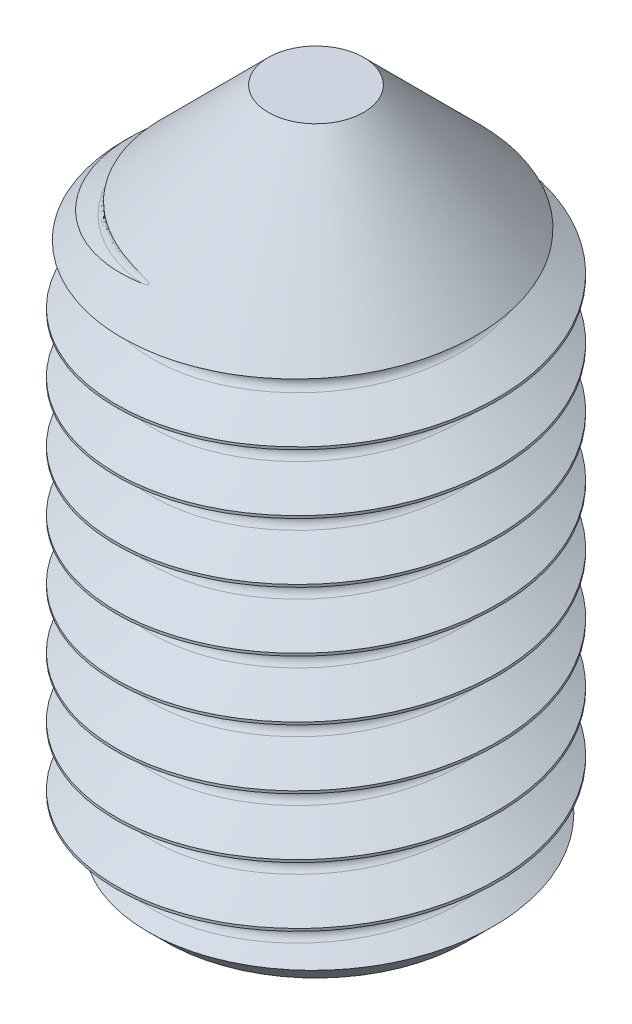
from build123d import *

# Parameters (mm, degrees)
SKETCH1_R           = 4
BOSS_EXTRUDE1_DEPTH = 7
CUT_EXTRUDE1_DEPTH  = 4
CUT_SWEEP1_PITCH    = 1.25


with BuildPart() as part:
    # Sketch1 → Boss-Extrude1 (new, symmetric)
    with BuildSketch(Plane(origin=(0, 0, 0), x_dir=(1, 0, 0), z_dir=(0, 1, 0))):
        with Locations(Location((0, 0, 0), (0, 0, 270))):
            Circle(SKETCH1_R)
    extrude(amount=BOSS_EXTRUDE1_DEPTH, both=True)

    # Sketch2 → Cut-Revolve1 (revolve, cut)
    with BuildSketch(Plane.XY, mode=Mode.PRIVATE) as cut_revolve1_sk:
        Polygon((1, 7), (7.00821077, 0.99178923), (7.00821077, -3.14178923), (3.15, -7), (3.15, -11.440460971), (10.721352994, -11.440460971), (10.721352994, 12.204396091), (1, 12.204396091), align=None)
    revolve(cut_revolve1_sk.sketch.rotate(Axis((0, 0, 0), (0, -1, 0)), 270), axis=Axis((0, 0, 0), (0, -1, 0)), mode=Mode.SUBTRACT)

    # Sketch3 → Cut-Extrude1 (cut)
    with BuildSketch(Plane.XZ.offset(7)):
        Polygon((2.045, -1.1806813), (2.045, 1.1806813), (0, 2.361362601), (-2.045, 1.1806813), (-2.045, -1.1806813), (0, -2.361362601), align=None)
    extrude(amount=-CUT_EXTRUDE1_DEPTH, mode=Mode.SUBTRACT)

    # Cut-Sweep1: the profile of Sketch5 screwed along a right-hand helix of 14.5 turns, 8 arcs to a turn; built about Z, then put on its axis
    cut_sweep1_z = Axis((0, 0, 0), (0, 0, 1))
    cut_sweep1_corners = [(-4.045598725, 0, 0.387991824), (-3.233716073, 0, -0.080748843), (-3.143528573, 0, -0.236958176), (-3.233716073, 0, -0.393167508), (-4.045598725, 0, -0.861908176)]
    with BuildLine(mode=Mode.PRIVATE) as cut_sweep1_profile:
        Line(cut_sweep1_corners[0], cut_sweep1_corners[1])
        Line(cut_sweep1_corners[3], cut_sweep1_corners[4])
        Line(cut_sweep1_corners[4], cut_sweep1_corners[0])
        ThreePointArc((-3.233716073, 0, -0.080748843), (-3.16769424, 0, -0.146770676), (-3.143528573, 0, -0.236958176))
        ThreePointArc((-3.143528573, 0, -0.236958176), (-3.16769424, 0, -0.327145676), (-3.233716073, 0, -0.393167508))
    cut_sweep1_cap = Face(cut_sweep1_profile.wire())
    cut_sweep1_arcs = [((-3.233716073, 0, -0.080748843), (-3.143528573, 0, -0.132818621), (-3.143528573, 0, -0.236958176), (1, 0.8660254037844423, 1)), ((-3.143528573, 0, -0.236958176), (-3.143528573, 0, -0.34109773), (-3.233716073, 0, -0.393167508), (1, 0.8660254037844423, 1))]  # start, shoulder, end, weights
    cut_sweep1_turn_angles = [0, 22.5, 45, 67.5, 90, 112.5, 135, 157.5, 180, 202.5, 225, 247.5, 270, 292.5, 315, 337.5, 360]
    cut_sweep1_turn_weights = [1, 0.9238795325112867, 1, 0.9238795325112867, 1, 0.9238795325112867, 1, 0.9238795325112867, 1, 0.9238795325112867, 1, 0.9238795325112867, 1, 0.9238795325112867, 1, 0.9238795325112867, 1]
    cut_sweep1_turn_rails = [Edge.make_bspline([Vector(p[0], p[1], 0).rotate(cut_sweep1_z, cut_sweep1_turn_angles[k]) / cut_sweep1_turn_weights[k] + Vector(0, 0, p[2] + CUT_SWEEP1_PITCH * cut_sweep1_turn_angles[k] / 360) for k in range(17)], [0, 0, 0, 1, 1, 2, 2, 3, 3, 4, 4, 5, 5, 6, 6, 7, 7, 8, 8, 8], 2, cut_sweep1_turn_weights) for p in cut_sweep1_corners]
    cut_sweep1_turn_sides = [*[Face.make_surface_from_curves(cut_sweep1_turn_rails[p[0]], cut_sweep1_turn_rails[p[1]]) for p in [(0, 1), (3, 4), (4, 0)]], *[Face.make_bezier_surface([[Vector(p[j][0], p[j][1], 0).rotate(cut_sweep1_z, cut_sweep1_turn_angles[2 * i + k]) / cut_sweep1_turn_weights[2 * i + k] + Vector(0, 0, p[j][2] + CUT_SWEEP1_PITCH * cut_sweep1_turn_angles[2 * i + k] / 360) for k in range(3)] for j in range(3)], [[p[3][j] * cut_sweep1_turn_weights[2 * i + k] for k in range(3)] for j in range(3)]) for p in cut_sweep1_arcs for i in range(8)]]
    cut_sweep1_last_angles = [5040, 5062.5, 5085, 5107.5, 5130, 5152.5, 5175, 5197.5, 5220]
    cut_sweep1_last_weights = [1, 0.9238795325112867, 1, 0.9238795325112867, 1, 0.9238795325112867, 1, 0.9238795325112321, 1]
    cut_sweep1_last_rails = [Edge.make_bspline([Vector(p[0], p[1], 0).rotate(cut_sweep1_z, cut_sweep1_last_angles[k]) / cut_sweep1_last_weights[k] + Vector(0, 0, p[2] + CUT_SWEEP1_PITCH * cut_sweep1_last_angles[k] / 360) for k in range(9)], [0, 0, 0, 1, 1, 2, 2, 3, 3, 4, 4, 4], 2, cut_sweep1_last_weights) for p in cut_sweep1_corners]
    cut_sweep1_last_sides = [*[Face.make_surface_from_curves(cut_sweep1_last_rails[p[0]], cut_sweep1_last_rails[p[1]]) for p in [(0, 1), (3, 4), (4, 0)]], *[Face.make_bezier_surface([[Vector(p[j][0], p[j][1], 0).rotate(cut_sweep1_z, cut_sweep1_last_angles[2 * i + k]) / cut_sweep1_last_weights[2 * i + k] + Vector(0, 0, p[j][2] + CUT_SWEEP1_PITCH * cut_sweep1_last_angles[2 * i + k] / 360) for k in range(3)] for j in range(3)], [[p[3][j] * cut_sweep1_last_weights[2 * i + k] for k in range(3)] for j in range(3)]) for p in cut_sweep1_arcs for i in range(4)]]
    cut_sweep1 = Plane(origin=(0, -7, 0), x_dir=(-1, 0, 0), z_dir=(0, 1, 0)) * Solid(Shell([*[p.moved(Location((0, 0, CUT_SWEEP1_PITCH * i))) for i in range(14) for p in cut_sweep1_turn_sides], *cut_sweep1_last_sides, cut_sweep1_cap, cut_sweep1_cap.rotate(cut_sweep1_z, 5220).moved(Location((0, 0, CUT_SWEEP1_PITCH * 5220 / 360)))]))
    add(cut_sweep1, mode=Mode.SUBTRACT)

    # Cut-Extrude2 cone 1 section (through the dimple's axis) → Cut-Extrude2 (revolve, cut)
    with BuildSketch(Plane(origin=(0, -7, 0), x_dir=(0, 0, -1), z_dir=(1, 0, 0))):
        Polygon((0, 0), (2.361362601, 0), (0, 0.632725202), align=None)
    revolve(axis=Axis((0, -7, 0), (0, 1, 0)), mode=Mode.SUBTRACT)


solid = part.part
